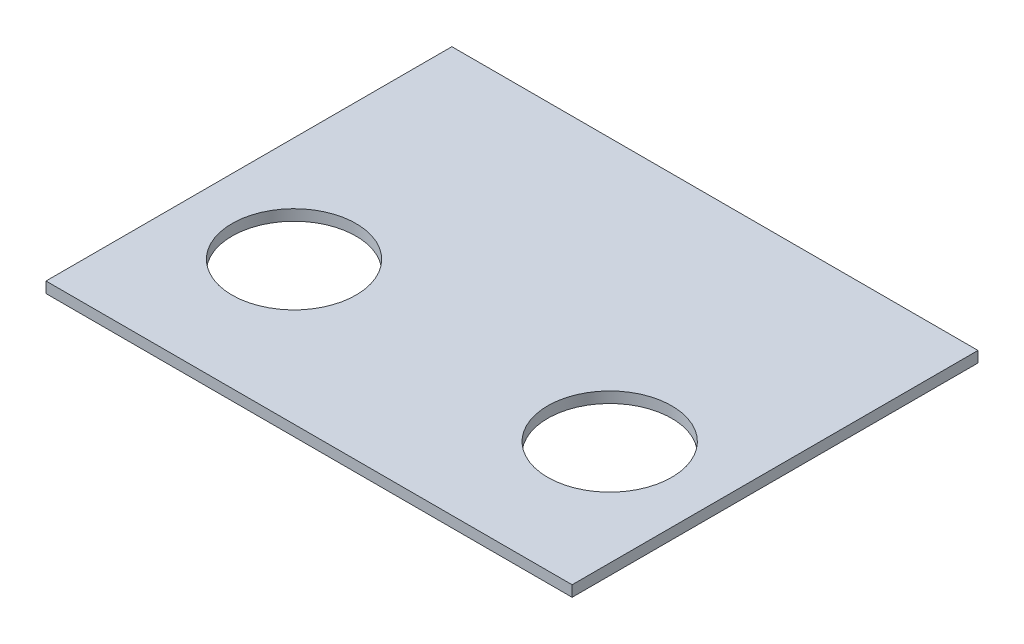
from build123d import *

# Parameters (mm, degrees)
ESQUISSE1_W             = 70
ESQUISSE1_H             = 54
BOSS_EXTRU_1_DEPTH      = 1.45
ESQUISSE2_R             = 8.25
ENL_V_MAT_EXTRU_1_DEPTH = 10
ESQUISSE4_R             = 8.25
ENL_V_MAT_EXTRU_3_DEPTH = 10


with BuildPart() as part:
    # Esquisse1 → Boss.-Extru.1 (new body)
    with BuildSketch(Plane(origin=(0, 0, 0), x_dir=(1, 0, 0), z_dir=(0, 1, 0))):
        Rectangle(ESQUISSE1_W, ESQUISSE1_H)
    extrude(amount=BOSS_EXTRU_1_DEPTH)

    # Esquisse2 → Enlèv. mat.-Extru.1 (cut)
    with BuildSketch(Plane(origin=(0, 1.45, 0), x_dir=(1, 0, 0), z_dir=(0, 1, 0))):
        with Locations((-21, -8)):
            Circle(ESQUISSE2_R)
    extrude(amount=-ENL_V_MAT_EXTRU_1_DEPTH, mode=Mode.SUBTRACT)

    # Esquisse4 → Enlèv. mat.-Extru.3 (cut)
    with BuildSketch(Plane(origin=(0, 1.45, 0), x_dir=(1, 0, 0), z_dir=(0, 1, 0))):
        with Locations((21, -8)):
            Circle(ESQUISSE4_R)
    extrude(amount=-ENL_V_MAT_EXTRU_3_DEPTH, mode=Mode.SUBTRACT)


solid = part.part
